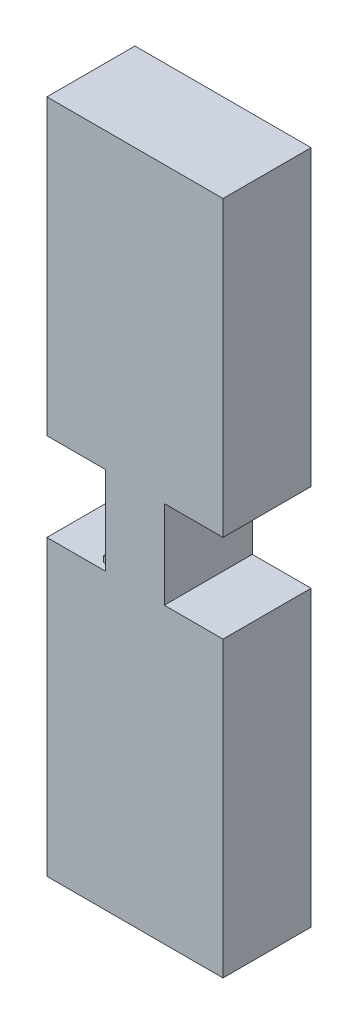
from build123d import *

# Parameters (mm, degrees)
SKETCH1_W           = 60
SKETCH1_H           = 100
BOSS_EXTRUDE1_DEPTH = 15
SKETCH2_W           = 60
SKETCH2_H           = 100
BOSS_EXTRUDE2_DEPTH = 15
SKETCH3_W           = 20
SKETCH3_H           = 30
BOSS_EXTRUDE3_DEPTH = 15
SKETCH4_W           = 1.5
SKETCH4_H           = 2
BOSS_EXTRUDE4_DEPTH = 14.25


with BuildPart() as part:
    # Sketch1 → Boss-Extrude1 (new, symmetric)
    with BuildSketch(Plane.XY):
        with Locations((0, -65)):
            Rectangle(SKETCH1_W, SKETCH1_H)
    extrude(amount=BOSS_EXTRUDE1_DEPTH, both=True)



with BuildPart() as body_2:
    # Sketch2 → Boss-Extrude2 (new, symmetric)
    with BuildSketch(Plane.XY):
        with Locations((0, 65)):
            Rectangle(SKETCH2_W, SKETCH2_H)
    extrude(amount=BOSS_EXTRUDE2_DEPTH, both=True)


with BuildPart() as part_1:
    add(part.part)

    add(body_2.part)  # Boss-Extrude3 merges body 2
    # Sketch3 → Boss-Extrude3 (add, symmetric)
    with BuildSketch(Plane.XY):
        Rectangle(SKETCH3_W, SKETCH3_H)
    extrude(amount=BOSS_EXTRUDE3_DEPTH, both=True)

    # Sketch4 → Boss-Extrude4 (add, symmetric)
    with BuildSketch(Plane.XY):
        with Locations((-10.75, -12.5)):
            Rectangle(SKETCH4_W, SKETCH4_H)
    extrude(amount=BOSS_EXTRUDE4_DEPTH, both=True)


solid = part_1.part
